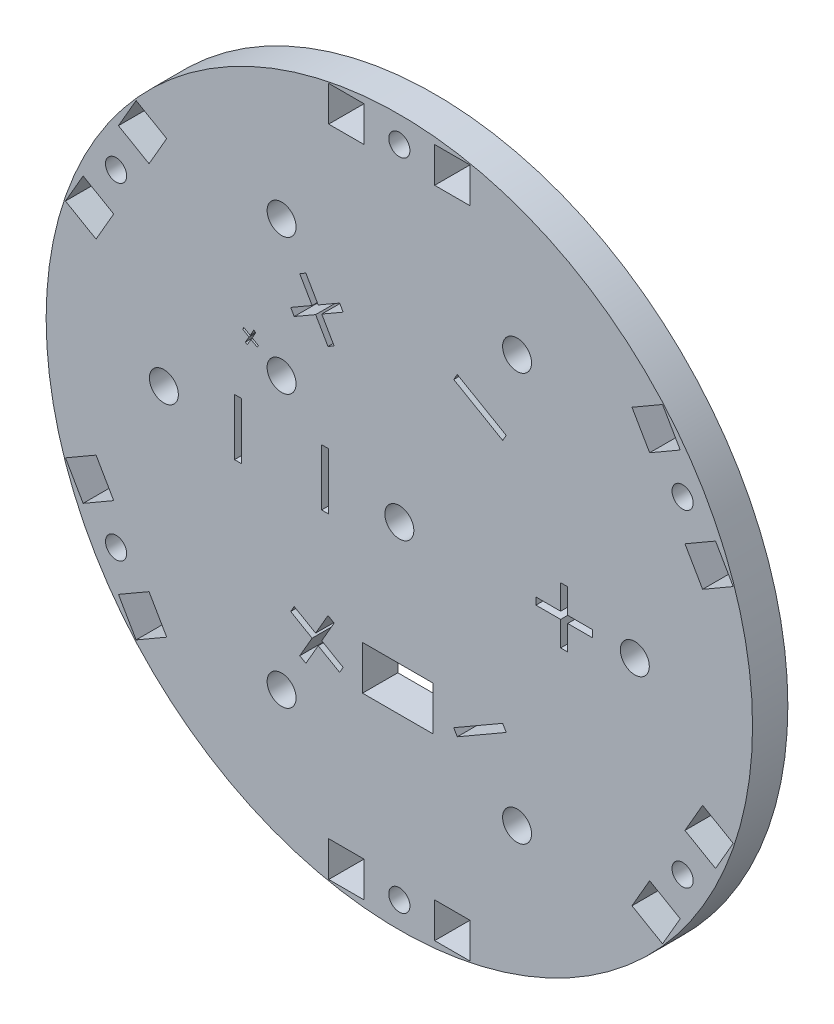
from build123d import *

# Parameters (mm, degrees)
BOSS_EXTRU_1_OUTLINE_R   = 50
BOSS_EXTRU_1_OUTLINE_W   = 5
BOSS_EXTRU_1_OUTLINE_H   = 5
BOSS_EXTRU_1_OUTLINE_R_2 = 2.05
BOSS_EXTRU_1_OUTLINE_R_3 = 1.5
BOSS_EXTRU_1_DEPTH       = 5
SKETCH3_W                = 1
SKETCH3_H                = 8
SKETCH3_W_2              = 10
SKETCH3_H_2              = 6.223903135
CUT_EXTRUDE2_DEPTH       = 10


# Read off the part's stored shape, not the designer's step: Boss.-Extru.1
with BuildPart() as part:
    # Boss.-Extru.1 outline → Boss.-Extru.1 (new body)
    with BuildSketch(Plane.XY):
        Circle(BOSS_EXTRU_1_OUTLINE_R)
        Polygon((-37.262039705, -33.060254038), (-39.762039705, -28.730127019), (-35.431912686, -26.230127019), (-32.931912686, -30.560254038), align=None, mode=Mode.SUBTRACT)
        with Locations((-7.5, -46.3)):
            Rectangle(BOSS_EXTRU_1_OUTLINE_W, BOSS_EXTRU_1_OUTLINE_H, mode=Mode.SUBTRACT)
        with Locations((-16.666666667, -28.867513459)):
            Circle(BOSS_EXTRU_1_OUTLINE_R_2, mode=Mode.SUBTRACT)
        with Locations((-40.096976195, -23.15)):
            Circle(BOSS_EXTRU_1_OUTLINE_R_3, mode=Mode.SUBTRACT)
        Polygon((-42.931912686, -13.239745962), (-40.431912686, -17.569872981), (-44.762039705, -20.069872981), (-47.262039705, -15.739745962), align=None, mode=Mode.SUBTRACT)
        with Locations((0, -46.3)):
            Circle(BOSS_EXTRU_1_OUTLINE_R_3, mode=Mode.SUBTRACT)
        with Locations((7.5, -46.3)):
            Rectangle(BOSS_EXTRU_1_OUTLINE_W, BOSS_EXTRU_1_OUTLINE_H, mode=Mode.SUBTRACT)
        with Locations((16.666666667, -28.867513459)):
            Circle(BOSS_EXTRU_1_OUTLINE_R_2, mode=Mode.SUBTRACT)
        Polygon((32.931912686, -30.560254038), (35.431912686, -26.230127019), (39.762039705, -28.730127019), (37.262039705, -33.060254038), align=None, mode=Mode.SUBTRACT)
        with Locations((40.096976195, -23.15)):
            Circle(BOSS_EXTRU_1_OUTLINE_R_3, mode=Mode.SUBTRACT)
        Polygon((47.262039705, -15.739745962), (44.762039705, -20.069872981), (40.431912686, -17.569872981), (42.931912686, -13.239745962), align=None, mode=Mode.SUBTRACT)
        with Locations((-33.333333333, 0)):
            Circle(BOSS_EXTRU_1_OUTLINE_R_2, mode=Mode.SUBTRACT)
        Polygon((-47.262039705, 15.739745962), (-44.762039705, 20.069872981), (-40.431912686, 17.569872981), (-42.931912686, 13.239745962), align=None, mode=Mode.SUBTRACT)
        with Locations((-40.096976195, 23.15)):
            Circle(BOSS_EXTRU_1_OUTLINE_R_3, mode=Mode.SUBTRACT)
        with Locations((-16.671397032, 9.625235564)):
            Circle(BOSS_EXTRU_1_OUTLINE_R_2, mode=Mode.SUBTRACT)
        Polygon((-32.931912686, 30.560254038), (-35.431912686, 26.230127019), (-39.762039705, 28.730127019), (-37.262039705, 33.060254038), align=None, mode=Mode.SUBTRACT)
        with Locations((-16.666666667, 28.867513459)):
            Circle(BOSS_EXTRU_1_OUTLINE_R_2, mode=Mode.SUBTRACT)
        with Locations((-7.5, 46.3)):
            Rectangle(BOSS_EXTRU_1_OUTLINE_W, BOSS_EXTRU_1_OUTLINE_H, mode=Mode.SUBTRACT)
        Circle(BOSS_EXTRU_1_OUTLINE_R_2, mode=Mode.SUBTRACT)
        with Locations((33.333333333, 0)):
            Circle(BOSS_EXTRU_1_OUTLINE_R_2, mode=Mode.SUBTRACT)
        Polygon((42.931912686, 13.239745962), (40.431912686, 17.569872981), (44.762039705, 20.069872981), (47.262039705, 15.739745962), align=None, mode=Mode.SUBTRACT)
        with Locations((40.096976195, 23.15)):
            Circle(BOSS_EXTRU_1_OUTLINE_R_3, mode=Mode.SUBTRACT)
        with Locations((16.666666667, 28.867513459)):
            Circle(BOSS_EXTRU_1_OUTLINE_R_2, mode=Mode.SUBTRACT)
        with Locations((0, 46.3)):
            Circle(BOSS_EXTRU_1_OUTLINE_R_3, mode=Mode.SUBTRACT)
        with Locations((7.5, 46.3)):
            Rectangle(BOSS_EXTRU_1_OUTLINE_W, BOSS_EXTRU_1_OUTLINE_H, mode=Mode.SUBTRACT)
        Polygon((37.262039705, 33.060254038), (39.762039705, 28.730127019), (35.431912686, 26.230127019), (32.931912686, 30.560254038), align=None, mode=Mode.SUBTRACT)
    extrude(amount=BOSS_EXTRU_1_DEPTH)

    # Sketch3 → Cut-Extrude2 (cut)
    with BuildSketch(Plane.XY.offset(5)):
        with Locations((-10.5, 0)):
            Rectangle(SKETCH3_W, SKETCH3_H)
        with Locations((-22.833333333, 0)):
            Rectangle(SKETCH3_W, SKETCH3_H)
        Polygon((-13.233653965, 23.921361037), (-14.099679369, 23.421361037), (-12.349679369, 20.390272124), (-15.380768282, 18.640272124), (-14.880768282, 17.77424672), (-11.849679369, 19.52424672), (-10.099679369, 16.493157806), (-9.233653965, 16.993157806), (-10.983653965, 20.02424672), (-7.952565052, 21.77424672), (-8.452565052, 22.640272124), (-11.483653965, 20.890272124), align=None)
        Polygon((15.130768282, 18.207259422), (14.630768282, 17.341234018), (7.702565052, 21.341234018), (8.202565052, 22.207259422), align=None)
        Polygon((8.202565052, -22.207259422), (7.702565052, -21.341234018), (14.630768282, -17.341234018), (15.130768282, -18.207259422), align=None)
        Polygon((27.333333333, -0.5), (27.333333333, 0.5), (23.833333333, 0.5), (23.833333333, 4), (22.833333333, 4), (22.833333333, 0.5), (19.333333333, 0.5), (19.333333333, -0.5), (22.833333333, -0.5), (22.833333333, -4), (23.833333333, -4), (23.833333333, -0.5), align=None)
        Polygon((-14.099679369, -23.421361037), (-13.233653965, -23.921361037), (-11.483653965, -20.890272124), (-8.452565052, -22.640272124), (-7.952565052, -21.77424672), (-10.983653965, -20.02424672), (-9.233653965, -16.993157806), (-10.099679369, -16.493157806), (-11.849679369, -19.52424672), (-14.880768282, -17.77424672), (-15.380768282, -18.640272124), (-12.349679369, -20.390272124), align=None)
        with Locations((-0.211745945, -20.453185586)):
            Rectangle(SKETCH3_W_2, SKETCH3_H_2)
        Polygon((-20.834234776, 12.184801987), (-19.940304487, 11.668776346), (-20.102964744, 11.386925384), (-20.996895032, 11.902951025), (-21.517828526, 11.000607275), (-21.800380609, 11.163968654), (-21.279447115, 12.066312404), (-22.173377404, 12.582338045), (-22.010717147, 12.864189006), (-21.116786859, 12.348163365), (-20.596554487, 13.24840375), (-20.314002404, 13.085042371), align=None)
    extrude(amount=-CUT_EXTRUDE2_DEPTH, mode=Mode.SUBTRACT)


solid = part.part
